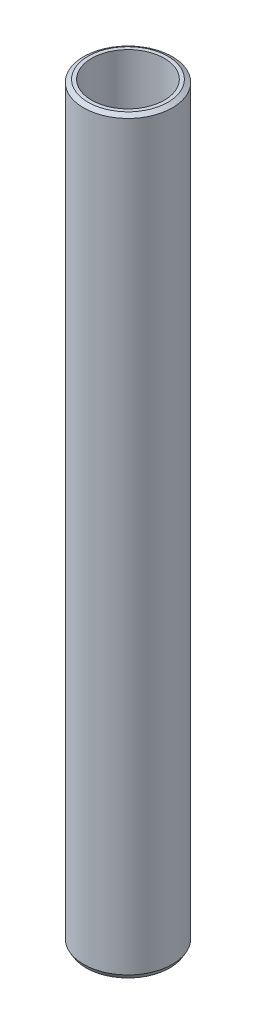
from build123d import *
from OCP.BRepFilletAPI import BRepFilletAPI_MakeChamfer

# Parameters (mm, degrees)
SKETCH1_R           = 32.5
BOSS_EXTRUDE1_DEPTH = 548.400233657
SKETCH2_R           = 26.6193422
CUT_EXTRUDE1_DEPTH  = 551.322919998
CHAMFER1_SIZE       = 1.884625382
CHAMFER1_SIZE2      = 3.264266914


with BuildPart() as part:
    # Sketch1 → Boss-Extrude1 (new body)
    with BuildSketch(Plane(origin=(0, 0, 0), x_dir=(1, 0, 0), z_dir=(0, 1, 0))):
        Circle(SKETCH1_R)
    extrude(amount=BOSS_EXTRUDE1_DEPTH)

    # Sketch2 → Cut-Extrude1 (cut, through all)
    with BuildSketch(Plane(origin=(0, 0, 0), x_dir=(1, 0, 0), z_dir=(0, 1, 0))):
        Circle(SKETCH2_R)
    extrude(amount=CUT_EXTRUDE1_DEPTH, mode=Mode.SUBTRACT)

    # Chamfer1: one chamfer whose edges measure the first distance from different faces: ONE call of the kernel's chamfer builder (chamfer() names one face for all edges)
    chamfer1_edges_1 = [part.edges().sort_by_distance(p)[0] for p in [
        (-32.5, 548.400233657, 0),
    ]]
    chamfer1_side_1 = [part.faces().sort_by_distance(p)[0] for p in [
        (-32.5, 274.200116829, 0),
    ]]
    chamfer1_edges_2 = [part.edges().sort_by_distance(p)[0] for p in [
        (-32.5, 0, 0),
    ]]
    chamfer1_side_2 = [part.faces().sort_by_distance(p)[0] for p in [
        (-31.580761184, 0, 0),
    ]]
    chamfer1 = BRepFilletAPI_MakeChamfer(part.part.solid().wrapped)
    for e in chamfer1_edges_1:
        chamfer1.Add(CHAMFER1_SIZE, CHAMFER1_SIZE2, e.wrapped, chamfer1_side_1[0].wrapped)  # the first distance lies on this face
    for e in chamfer1_edges_2:
        chamfer1.Add(CHAMFER1_SIZE, CHAMFER1_SIZE2, e.wrapped, chamfer1_side_2[0].wrapped)  # the first distance lies on this face
    add(Compound.cast(chamfer1.Shape()), mode=Mode.REPLACE)


solid = part.part
